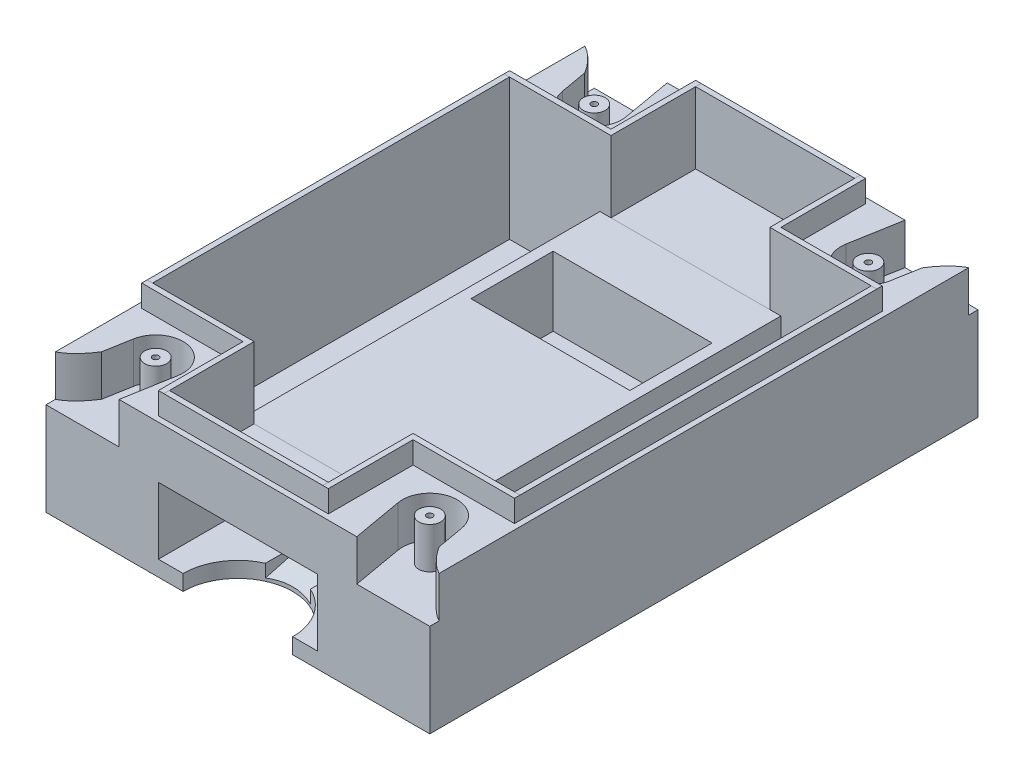
from build123d import *

# Parameters (mm, degrees)
CROQUIS1_W                    = 70
CROQUIS1_H                    = 100
SALIENTE_EXTRUIR1_DEPTH       = 15
CROQUIS2_W                    = 29
CROQUIS2_H                    = 12.15
CORTAR_EXTRUIR1_DEPTH         = 72
CORTAR_EXTRUIR2_DEPTH         = 72
CROQUIS4_W                    = 9
CROQUIS4_H                    = 1.6
CORTAR_EXTRUIR3_DEPTH         = 2
CROQUIS6_W                    = 8.2
CROQUIS6_H                    = 2
CORTAR_EXTRUIR4_DEPTH         = 94.926889384
CORTAR_EXTRUIR5_DEPTH         = 8.2
CROQUIS8_W                    = 70
CROQUIS8_H                    = 57
SALIENTE_EXTRUIR3_DEPTH       = 2
CROQUIS9_W                    = 20.5
CROQUIS9_H                    = 15
SALIENTE_EXTRUIR4_DEPTH       = 2
CROQUIS10_W                   = 70
CROQUIS10_H                   = 22.450330877
SALIENTE_EXTRUIR5_DEPTH       = 2
CROQUIS12_W                   = 70
CROQUIS12_H                   = 100
CROQUIS12_W_2                 = 29
CROQUIS12_H_2                 = 15
SALIENTE_EXTRUIR6_DEPTH       = 7.5
CROQUIS11_R                   = 2
CORTAR_EXTRUIR6_DEPTH         = 7.5
CORTAR_EXTRUIR7_DEPTH         = 7.5
CROQUIS15_W                   = 29
CROQUIS15_H                   = 8.521564644
CORTAR_EXTRUIR8_DEPTH         = 109.743965496
CROQUIS16_W                   = 70
CROQUIS16_H                   = 65.095762462
CORTAR_EXTRUIR9_DEPTH         = 9
CROQUIS17_W                   = 29
CROQUIS17_H                   = 17.452118769
CORTAR_EXTRUIR10_DEPTH        = 0.48
CROQUIS19_W                   = 16.5
CROQUIS19_H                   = 65.095762462
CORTAR_EXTRUIR12_DEPTH        = 12.65
CORTAR_EXTRUIR13_DEPTH        = 66.766633044
CORTAR_EXTRUIR13_DEPTH_BACK   = 66.766633044
CROQUIS23_R                   = 0.56
CROQUIS24_W                   = 29
CROQUIS24_H                   = 1
CROQUIS24_W_2                 = 1
CROQUIS24_H_2                 = 65.095762462
SALIENTE_EXTRUIR8_DEPTH       = 13
SALIENTE_EXTRUIR9_START       = -0.001564644
SALIENTE_EXTRUIR9_OUTLINE_W   = 29
SALIENTE_EXTRUIR9_OUTLINE_H   = 1
SALIENTE_EXTRUIR9_OUTLINE_W_2 = 1
SALIENTE_EXTRUIR9_OUTLINE_H_2 = 65.095762462
SALIENTE_EXTRUIR9_DEPTH       = 9.001564644
SALIENTE_EXTRUIR10_DEPTH      = 4


# Read off the part's stored shape, not the designer's step: Saliente-Extruir9
with BuildPart() as part:
    # Croquis1 → Saliente-Extruir1 (new body)
    with BuildSketch(Plane(origin=(0, 0, 0), x_dir=(1, 0, 0), z_dir=(0, 1, 0))):
        Rectangle(CROQUIS1_W, CROQUIS1_H)
    extrude(amount=SALIENTE_EXTRUIR1_DEPTH)

    # Croquis2 → Cortar-Extruir1 (cut)
    with BuildSketch(Plane.XY.offset(50)):
        with Locations((0, 8.925)):
            Rectangle(CROQUIS2_W, CROQUIS2_H)
    extrude(amount=-CORTAR_EXTRUIR1_DEPTH, mode=Mode.SUBTRACT)

    # Croquis3 → Cortar-Extruir2 (cut)
    with BuildSketch(Plane.XZ):
        with BuildLine():
            Line((-10, 50), (10, 50))
            ThreePointArc((10, 50), (0, 40), (-10, 50))
        make_face()
    extrude(amount=-CORTAR_EXTRUIR2_DEPTH, mode=Mode.SUBTRACT)

    # Croquis4 → Cortar-Extruir3 (cut)
    with BuildSketch(Plane(origin=(0, 2.85, 0), x_dir=(1, 0, 0), z_dir=(0, 1, 0))):
        with Locations((0, -35.061869007)):
            Rectangle(CROQUIS4_W, CROQUIS4_H)
    extrude(amount=-CORTAR_EXTRUIR3_DEPTH, mode=Mode.SUBTRACT)

    # Croquis6 → Cortar-Extruir4 (cut, through all)
    with BuildSketch(Plane(origin=(0, 0, 35.861869007), x_dir=(-1, 0, 0), z_dir=(0, 0, -1))):
        with Locations((0, 2.85)):
            Rectangle(CROQUIS6_W, CROQUIS6_H)
    extrude(amount=-CORTAR_EXTRUIR4_DEPTH, mode=Mode.SUBTRACT)

    # Croquis7 → Cortar-Extruir5 (cut)
    with BuildSketch(Plane(origin=(-4.1, 0, 0), x_dir=(0, 0, -1), z_dir=(1, 0, 0))):
        Polygon((-40.879144777, 0.510423286), (-35.861869007, 1.85), (-40.879144777, 1.85), align=None)
    extrude(amount=CORTAR_EXTRUIR5_DEPTH, mode=Mode.SUBTRACT)

    # Croquis8 → Saliente-Extruir3 (add)
    with BuildSketch(Plane(origin=(0, 15, 0), x_dir=(1, 0, 0), z_dir=(0, 1, 0))):
        with Locations((0, -21.5)):
            Rectangle(CROQUIS8_W, CROQUIS8_H)
        Polygon((14.5, 22), (35, 22), (35, 27.549669123), (-35, 27.549669123), (-35, 22), align=None)
    extrude(amount=SALIENTE_EXTRUIR3_DEPTH)

    # Croquis9 → Saliente-Extruir4 (add)
    with BuildSketch(Plane(origin=(0, 15, 0), x_dir=(1, 0, 0), z_dir=(0, 1, 0))):
        with Locations((-24.75, 14.5)):
            Rectangle(CROQUIS9_W, CROQUIS9_H)
        with Locations((24.75, 14.5)):
            Rectangle(CROQUIS9_W, CROQUIS9_H)
    extrude(amount=SALIENTE_EXTRUIR4_DEPTH)

    # Croquis10 → Saliente-Extruir5 (add)
    with BuildSketch(Plane(origin=(0, 15, 0), x_dir=(1, 0, 0), z_dir=(0, 1, 0))):
        with Locations((0, 38.774834562)):
            Rectangle(CROQUIS10_W, CROQUIS10_H)
    extrude(amount=SALIENTE_EXTRUIR5_DEPTH)

    # Croquis12 → Saliente-Extruir6 (add)
    with BuildSketch(Plane(origin=(0, 17, 0), x_dir=(1, 0, 0), z_dir=(0, 1, 0))):
        Rectangle(CROQUIS12_W, CROQUIS12_H)
        with Locations((0, 14.5)):
            Rectangle(CROQUIS12_W_2, CROQUIS12_H_2, mode=Mode.SUBTRACT)
    extrude(amount=SALIENTE_EXTRUIR6_DEPTH)

    # Croquis11 → Cortar-Extruir6 (cut)
    # profile 1 of 4: a face of its own
    with BuildSketch(Plane(origin=(0, 17, 0), x_dir=(1, 0, 0), z_dir=(0, 1, 0))):
        with BuildLine():
            Line((20.075961235, 40.868240888), (21.812443012, 50.716318418))
            ThreePointArc((21.812443012, 50.716318418), (27.604722665, 54.772116295), (31.660520542, 48.979836642))
            Line((31.660520542, 48.979836642), (29.924038765, 39.131759112))
            ThreePointArc((29.924038765, 39.131759112), (24.131759112, 35.075961235), (20.075961235, 40.868240888))
        make_face()
        with Locations(Location((25, 40, 0), (0, 0, 270))):
            Circle(CROQUIS11_R, mode=Mode.SUBTRACT)
    # profile 2 of 4: a face of its own
    with BuildSketch(Plane(origin=(0, 17, 0), x_dir=(1, 0, 0), z_dir=(0, 1, 0))):
        with BuildLine():
            Line((-20.075961235, 40.868240888), (-21.812443012, 50.716318418))
            ThreePointArc((-21.812443012, 50.716318418), (-27.604722665, 54.772116295), (-31.660520542, 48.979836642))
            Line((-31.660520542, 48.979836642), (-29.924038765, 39.131759112))
            ThreePointArc((-29.924038765, 39.131759112), (-24.131759112, 35.075961235), (-20.075961235, 40.868240888))
        make_face()
        with Locations(Location((-25, 40, 0), (0, 0, 90))):
            Circle(CROQUIS11_R, mode=Mode.SUBTRACT)
    # profile 3 of 4: a face of its own
    with BuildSketch(Plane(origin=(0, 17, 0), x_dir=(1, 0, 0), z_dir=(0, 1, 0))):
        with BuildLine():
            Line((20.075961235, -40.868240888), (21.812443012, -50.716318418))
            ThreePointArc((21.812443012, -50.716318418), (27.604722665, -54.772116295), (31.660520542, -48.979836642))
            Line((31.660520542, -48.979836642), (29.924038765, -39.131759112))
            ThreePointArc((29.924038765, -39.131759112), (24.131759112, -35.075961235), (20.075961235, -40.868240888))
        make_face()
        with Locations(Location((25, -40, 0), (0, 0, 90))):
            Circle(CROQUIS11_R, mode=Mode.SUBTRACT)
    # profile 4 of 4: a face of its own
    with BuildSketch(Plane(origin=(0, 17, 0), x_dir=(1, 0, 0), z_dir=(0, 1, 0))):
        with BuildLine():
            Line((-20.075961235, -40.868240888), (-21.812443012, -50.716318418))
            ThreePointArc((-21.812443012, -50.716318418), (-27.604722665, -54.772116295), (-31.660520542, -48.979836642))
            Line((-31.660520542, -48.979836642), (-29.924038765, -39.131759112))
            ThreePointArc((-29.924038765, -39.131759112), (-24.131759112, -35.075961235), (-20.075961235, -40.868240888))
        make_face()
        with Locations(Location((-25, -40, 0), (0, 0, 270))):
            Circle(CROQUIS11_R, mode=Mode.SUBTRACT)
    extrude(amount=CORTAR_EXTRUIR6_DEPTH, mode=Mode.SUBTRACT)

    # Croquis13 → Cortar-Extruir7 (cut)
    with BuildSketch(Plane(origin=(0, 24.5, 0), x_dir=(1, 0, 0), z_dir=(0, 1, 0))):
        with BuildLine():
            Line((30.792279653, 44.055797877), (30.792279653, 51.405221368))
            Line((30.792279653, 51.405221368), (45.333912294, 51.405221368))
            Line((45.333912294, 51.405221368), (45.333912294, 48.355988615))
            add(Edge.make_bspline(
                [(30.792279653, 44.055797877), (35.665326883, 51.984846729), (45.333912294, 48.355988615)],
                knots=[0, 0, 0, 1, 1, 1], degree=2))
        make_face()
        with BuildLine():
            Line((-30.792279653, 51.405221368), (-45.333912294, 51.405221368))
            Line((-45.333912294, 51.405221368), (-45.333912294, 48.355988615))
            add(Edge.make_bspline(
                [(-30.792279653, 44.055797877), (-35.665326883, 51.984846729), (-45.333912294, 48.355988615)],
                knots=[0, 0, 0, 1, 1, 1], degree=2))
            Line((-30.792279653, 44.055797877), (-30.792279653, 51.405221368))
        make_face()
        with BuildLine():
            Line((30.792279653, -51.405221368), (45.333912294, -51.405221368))
            Line((45.333912294, -51.405221368), (45.333912294, -48.355988615))
            add(Edge.make_bspline(
                [(30.792279653, -44.055797877), (35.665326883, -51.984846729), (45.333912294, -48.355988615)],
                knots=[0, 0, 0, 1, 1, 1], degree=2))
            Line((30.792279653, -44.055797877), (30.792279653, -51.405221368))
        make_face()
        with BuildLine():
            Line((-30.792279653, -44.055797877), (-30.792279653, -51.405221368))
            Line((-30.792279653, -51.405221368), (-45.333912294, -51.405221368))
            Line((-45.333912294, -51.405221368), (-45.333912294, -48.355988615))
            add(Edge.make_bspline(
                [(-30.792279653, -44.055797877), (-35.665326883, -51.984846729), (-45.333912294, -48.355988615)],
                knots=[0, 0, 0, 1, 1, 1], degree=2))
        make_face()
    extrude(amount=-CORTAR_EXTRUIR7_DEPTH, mode=Mode.SUBTRACT)

    # Croquis15 → Cortar-Extruir8 (cut, through all)
    with BuildSketch(Plane(origin=(0, 0, -50), x_dir=(-1, 0, 0), z_dir=(0, 0, -1))):
        with Locations((0, 20.239217678)):
            Rectangle(CROQUIS15_W, CROQUIS15_H)
    extrude(amount=-CORTAR_EXTRUIR8_DEPTH, mode=Mode.SUBTRACT)

    # Croquis16 → Cortar-Extruir9 (cut)
    with BuildSketch(Plane(origin=(0, 24.5, 0), x_dir=(1, 0, 0), z_dir=(0, 1, 0))):
        Rectangle(CROQUIS16_W, CROQUIS16_H)
    extrude(amount=-CORTAR_EXTRUIR9_DEPTH, mode=Mode.SUBTRACT)

    # Croquis17 → Cortar-Extruir10 (cut)
    with BuildSketch(Plane(origin=(0, 15.978435356, 0), x_dir=(1, 0, 0), z_dir=(0, 1, 0))):
        with Locations((0, 41.273940616)):
            Rectangle(CROQUIS17_W, CROQUIS17_H)
        with Locations((0, -41.273940616)):
            Rectangle(CROQUIS17_W, CROQUIS17_H)
    extrude(amount=-CORTAR_EXTRUIR10_DEPTH, mode=Mode.SUBTRACT)

    # Croquis19 → Cortar-Extruir12 (cut)
    with BuildSketch(Plane(origin=(0, 15.5, 0), x_dir=(1, 0, 0), z_dir=(0, 1, 0))):
        with Locations((-24.75, 0)):
            Rectangle(CROQUIS19_W, CROQUIS19_H)
    cortar_extruir12 = extrude(amount=-CORTAR_EXTRUIR12_DEPTH, mode=Mode.SUBTRACT)

    # Simetría1: Cortar-Extruir12 across plane
    add(cortar_extruir12.mirror(Plane(origin=(0, 0, 0), x_dir=(0, 0, 1), z_dir=(1, 0, 0))), mode=Mode.SUBTRACT)

    # Croquis23 → Cortar-Extruir13 (cut, two sides: drawn at the far end of the back side and taken through both)
    with BuildSketch(Plane(origin=(0, 24.5, 0), x_dir=(1, 0, 0), z_dir=(0, 1, 0)).offset(-CORTAR_EXTRUIR13_DEPTH_BACK)):
        with Locations(Location((-25, -40, 0), (0, 0, 270))):
            Circle(CROQUIS23_R)
        with Locations(Location((-25, 40, 0), (0, 0, 90))):
            Circle(CROQUIS23_R)
        with Locations(Location((25, 40, 0), (0, 0, 270))):
            Circle(CROQUIS23_R)
        with Locations(Location((25, -40, 0), (0, 0, 90))):
            Circle(CROQUIS23_R)
    extrude(amount=CORTAR_EXTRUIR13_DEPTH + CORTAR_EXTRUIR13_DEPTH_BACK, mode=Mode.SUBTRACT)

    # Croquis24 → Saliente-Extruir8 (add)
    with BuildSketch(Plane(origin=(0, 15.498435356, 0), x_dir=(1, 0, 0), z_dir=(0, 1, 0))):
        with Locations((0, -48.5)):
            Rectangle(CROQUIS24_W, CROQUIS24_H)
        with Locations((33.5, 0)):
            Rectangle(CROQUIS24_W_2, CROQUIS24_H_2)
        with Locations((-33.5, 0)):
            Rectangle(CROQUIS24_W_2, CROQUIS24_H_2)
        with Locations((0, 48.5)):
            Rectangle(CROQUIS24_W, CROQUIS24_H)
    extrude(amount=SALIENTE_EXTRUIR8_DEPTH)

    # Saliente-Extruir9 outline → Saliente-Extruir9 (add)
    with BuildSketch(Plane(origin=(0, 15.5, 0), x_dir=(1, 0, 0), z_dir=(0, 1, 0)).offset(SALIENTE_EXTRUIR9_START)):
        with Locations((0, 49.5)):
            Rectangle(SALIENTE_EXTRUIR9_OUTLINE_W, SALIENTE_EXTRUIR9_OUTLINE_H)
        with Locations((-34.5, 0)):
            Rectangle(SALIENTE_EXTRUIR9_OUTLINE_W_2, SALIENTE_EXTRUIR9_OUTLINE_H_2)
        with Locations((34.5, 0)):
            Rectangle(SALIENTE_EXTRUIR9_OUTLINE_W_2, SALIENTE_EXTRUIR9_OUTLINE_H_2)
        with Locations((0, -49.5)):
            Rectangle(SALIENTE_EXTRUIR9_OUTLINE_W, SALIENTE_EXTRUIR9_OUTLINE_H)
    extrude(amount=SALIENTE_EXTRUIR9_DEPTH)

    # Croquis26 → Saliente-Extruir10 (add)
    with BuildSketch(Plane(origin=(0, 24.5, 0), x_dir=(1, 0, 0), z_dir=(0, 1, 0))):
        Polygon((-14.5, -49), (-15.5, -49), (-15.5, -33.547881231), (-34, -33.547881231), (-34, -32.547881231), (-14.5, -32.547881231), align=None)
        Polygon((14.5, -49), (14.5, -32.547881231), (34, -32.547881231), (34, -33.547881231), (15.5, -33.547881231), (15.5, -49), align=None)
        Polygon((14.5, 49), (15.5, 49), (15.5, 33.547881231), (34, 33.547881231), (34, 32.547881231), (14.5, 32.547881231), align=None)
        Polygon((-14.5, 49), (-14.5, 32.547881231), (-34, 32.547881231), (-34, 33.547881231), (-15.5, 33.547881231), (-15.5, 49), align=None)
    extrude(amount=SALIENTE_EXTRUIR10_DEPTH)


solid = part.part
